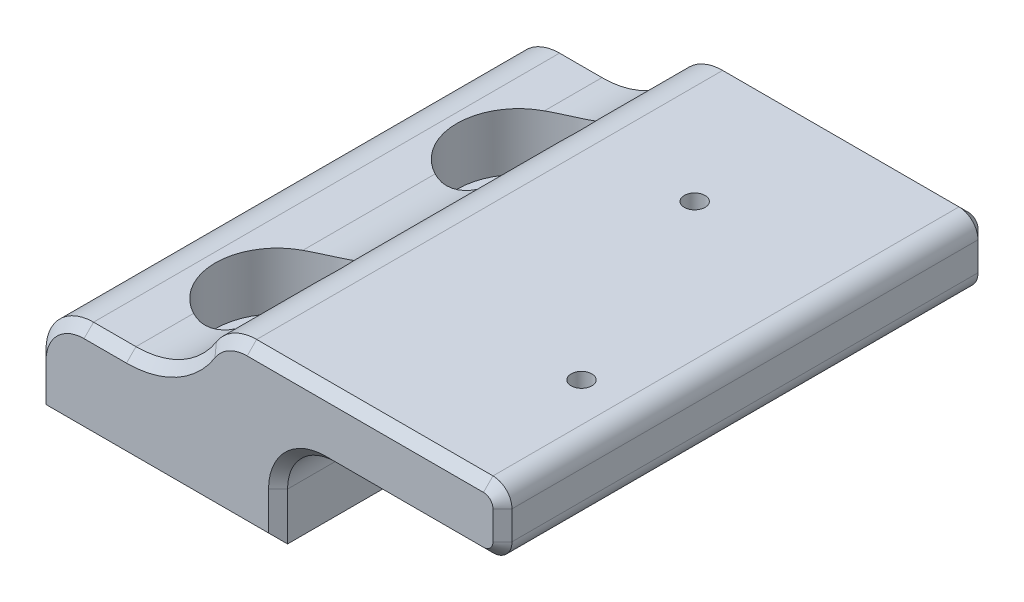
from build123d import *

# Parameters (mm, degrees)
BOSS_EXTRUDE1_DEPTH = 25.5
SKETCH3_R           = 4
CUT_EXTRUDE1_DEPTH  = 39.320882036
SKETCH3_4_R         = 6.5
SKETCH3_4_R_2       = 4
CUT_EXTRUDE2_DEPTH  = 6
SKETCH9_R           = 1.0922
CUT_EXTRUDE3_DEPTH  = 41.712283159
FILLET1_R           = 10
FILLET2_R           = 5
FILLET4_R           = 2
CHAMFER1_SIZE       = 1


with BuildPart() as part:
    # Sketch1 → Boss-Extrude1 (new, symmetric)
    with BuildSketch(Plane.XY):
        Polygon((-22.2, -8.5), (3.2, -8.5), (3.2, 1.5), (26.8, 1.5), (26.8, 8.5), (-3.2, 8.5), (-3.2, 1.5), (-22.2, 1.5), align=None)
    extrude(amount=BOSS_EXTRUDE1_DEPTH, both=True)

    # Sketch3 → Cut-Extrude1 (cut, through all)
    with BuildSketch(Plane(origin=(0, 1.5, 0), x_dir=(1, 0, 0), z_dir=(0, 1, 0))):
        with Locations(Location((-9.7, -12.7, 0), (0, 0, 180))):
            Circle(SKETCH3_R)
    cut_extrude1 = extrude(amount=-CUT_EXTRUDE1_DEPTH, mode=Mode.SUBTRACT)

    # Sketch3<4> → Cut-Extrude2 (cut)
    with BuildSketch(Plane(origin=(0, 1.5, 0), x_dir=(1, 0, 0), z_dir=(0, 1, 0))):
        with Locations(Location((-9.7, -12.7, 0), (0, 0, 180))):
            Circle(SKETCH3_4_R)
        with Locations(Location((-9.7, -12.7, 0), (0, 0, 180))):
            Circle(SKETCH3_4_R_2, mode=Mode.SUBTRACT)
    cut_extrude2 = extrude(amount=-CUT_EXTRUDE2_DEPTH, mode=Mode.SUBTRACT)

    # Mirror1: Cut-Extrude1, Cut-Extrude2 across plane
    add(cut_extrude1.mirror(Plane.XY), mode=Mode.SUBTRACT)
    add(cut_extrude2.mirror(Plane.XY), mode=Mode.SUBTRACT)

    # Sketch9 → Cut-Extrude3 (cut, through all)
    with BuildSketch(Plane(origin=(0, 8.5, 0), x_dir=(1, 0, 0), z_dir=(0, 1, 0))):
        with Locations(Location((10.4078, 11.1, 0), (0, 0, 180))):
            Circle(SKETCH9_R)
        with Locations(Location((20.7078, -11.1, 0), (0, 0, 180))):
            Circle(SKETCH9_R)
    extrude(amount=-CUT_EXTRUDE3_DEPTH, mode=Mode.SUBTRACT)

    # Fillet1
    # the kernel refuses this fillet: 10 mm, written as the material it adds along each edge
    with BuildSketch(Plane(origin=(-3.2, 1.5, 25.5), x_dir=(0, 1, 0), z_dir=(0, 0, -1))) as fillet1_piece_1_section:
        with BuildLine():
            CenterArc((10, -9.539392014), FILLET1_R, 107.457603124, 72.542396876)
            Line((0, -9.539392014), (0, 0))
            Line((0, 0), (7, 0))
        make_face()
    fillet1_piece_1 = extrude(amount=12.8, mode=Mode.PRIVATE)
    fillet1_piece_1 = fillet1_piece_1 - Plane(origin=(-9.7, 1.5, 12.7), x_dir=(-1, 0, 0), z_dir=(0, 1, 0)) * Cylinder(6.5, 64, mode=Mode.PRIVATE)
    add(fillet1_piece_1)
    with BuildSketch(Plane(origin=(-3.2, 1.5, -12.700000035), x_dir=(0, 1, 0), z_dir=(0, 0, -1))) as fillet1_piece_2_section:
        with BuildLine():
            CenterArc((10, -9.539392014), FILLET1_R, 107.457603124, 72.542396876)
            Line((0, -9.539392014), (0, 0))
            Line((0, 0), (7, 0))
        make_face()
    fillet1_piece_2 = extrude(amount=12.799999965, mode=Mode.PRIVATE)
    fillet1_piece_2 = fillet1_piece_2 - Plane(origin=(-9.7, 1.5, -12.7), x_dir=(-1, 0, 0), z_dir=(0, 1, 0)) * Cylinder(6.5, 64, mode=Mode.PRIVATE)
    add(fillet1_piece_2)
    with BuildSketch(Plane(origin=(-3.2, 1.5, 12.7), x_dir=(0, 1, 0), z_dir=(0, 0, -1))) as fillet1_piece_3_section:
        with BuildLine():
            CenterArc((10, -9.539392014), FILLET1_R, 107.457603124, 72.542396876)
            Line((0, -9.539392014), (0, 0))
            Line((0, 0), (7, 0))
        make_face()
    fillet1_piece_3 = extrude(amount=25.400000035, mode=Mode.PRIVATE)
    fillet1_piece_3 = fillet1_piece_3 - Plane(origin=(-9.7, 1.5, -12.7), x_dir=(-1, 0, 0), z_dir=(0, 1, 0)) * Cylinder(6.5, 89, mode=Mode.PRIVATE)
    fillet1_piece_3 = fillet1_piece_3 - Plane(origin=(-9.7, 1.5, 12.7), x_dir=(-1, 0, 0), z_dir=(0, 1, 0)) * Cylinder(6.5, 89, mode=Mode.PRIVATE)
    add(fillet1_piece_3)

    # Fillet2
    # the kernel refuses this fillet: 5 mm, written as the material it adds along each edge
    with BuildSketch(Plane(origin=(3.2, 1.5, -25.5), x_dir=(0, -1, 0), z_dir=(0, 0, 1))) as fillet2_piece_1:
        with BuildLine():
            CenterArc((FILLET2_R, FILLET2_R), FILLET2_R, 180, 90)
            Line((0, FILLET2_R), (0, 0))
            Line((0, 0), (FILLET2_R, 0))
        make_face()
    extrude(amount=51)
    # the kernel refuses this fillet: 5 mm, written as the material it takes off along each edge
    with BuildSketch(Plane(origin=(-3.2, 8.5, -33.372963816), x_dir=(1, 0, 0), z_dir=(0, 0, 1))) as fillet2_2_piece_1:
        with BuildLine():
            CenterArc((3.149185526, -5), FILLET2_R, 90, 57.769047364)
            ThreePointArc((-1.080340321, -2.333333333), (-0.464861443, -1.201534828), (0, 0))
            Line((0, 0), (3.149185526, 0))
        make_face()
    extrude(amount=20.67296378, mode=Mode.SUBTRACT)
    with BuildSketch(Plane(origin=(-22.2, 1.5, 38), x_dir=(1, 0, 0), z_dir=(0, 0, -1))) as fillet2_2_piece_2:
        with BuildLine():
            CenterArc((FILLET2_R, FILLET2_R), FILLET2_R, 180, 90)
            Line((0, FILLET2_R), (0, 0))
            Line((0, 0), (FILLET2_R, 0))
        make_face()
    extrude(amount=76, mode=Mode.SUBTRACT)
    with BuildSketch(Plane(origin=(-3.2, 8.5, -12.700000035), x_dir=(-0.42015348282673015, -0.9074530571156663, 0), z_dir=(0, 0, 1))) as fillet2_2_piece_3:
        with BuildLine():
            CenterArc((3.214124019, 4.958505447), FILLET2_R, 204.84427788, 57.769047364)
            Line((-1.323141267, 2.857738033), (0, 0))
            ThreePointArc((0, 0), (1.285649607, 0.082989105), (2.571299215, 0))
        make_face()
    extrude(amount=25.400000035, mode=Mode.SUBTRACT)
    with BuildSketch(Plane(origin=(-3.2, 8.5, 12.7), x_dir=(1, 0, 0), z_dir=(0, 0, 1))) as fillet2_2_piece_4:
        with BuildLine():
            CenterArc((3.149185526, -5), FILLET2_R, 90, 57.769047364)
            ThreePointArc((-1.080340321, -2.333333333), (-0.464861443, -1.201534828), (0, 0))
            Line((0, 0), (3.149185526, 0))
        make_face()
    extrude(amount=20.672963816, mode=Mode.SUBTRACT)

    # Fillet4
    fillet4_edges = [part.edges().sort_by_distance(p)[0] for p in [
        (26.8, 8.5, 0),
        (26.8, 1.5, 0),
    ]]
    fillet(fillet4_edges, radius=FILLET4_R)

    # Chamfer1
    chamfer1_edges = [part.edges().sort_by_distance(p)[0] for p in [
        (12.374592763, 8.5, 25.5),
        (12.374592763, 8.5, -25.5),
        (26.8, 5, -25.5),
        (26.214213562, 2.085786438, -25.5),
        (26.214213562, 7.914213562, -25.5),
        (26.8, 5, 25.5),
        (26.214213562, 2.085786438, 25.5),
        (26.214213562, 7.914213562, 25.5),
        (3.2, -6, -25.5),
        (-9.5, -8.5, -25.5),
        (3.2, -6, 25.5),
        (-14.969696007, 1.5, -25.5),
        (-14.969696007, 1.5, 25.5),
        (-7.908933099, 2.744049642, -25.5),
        (-7.908933099, 2.744049642, 25.5),
        (-22.2, -6, 25.5),
        (16.5, 1.5, 25.5),
        (-20.735533906, 0.035533906, 25.5),
        (-2.466043931, 7.877975179, 25.5),
        (-22.2, -6, -25.5),
        (16.5, 1.5, -25.5),
        (-20.735533906, 0.035533906, -25.5),
        (-2.466043931, 7.877975179, -25.5),
        (4.664466094, 0.035533906, -25.5),
        (4.664466094, 0.035533906, 25.5),
        (-9.5, -8.5, 25.5),
    ]]
    chamfer(chamfer1_edges, length=CHAMFER1_SIZE)


solid = part.part
